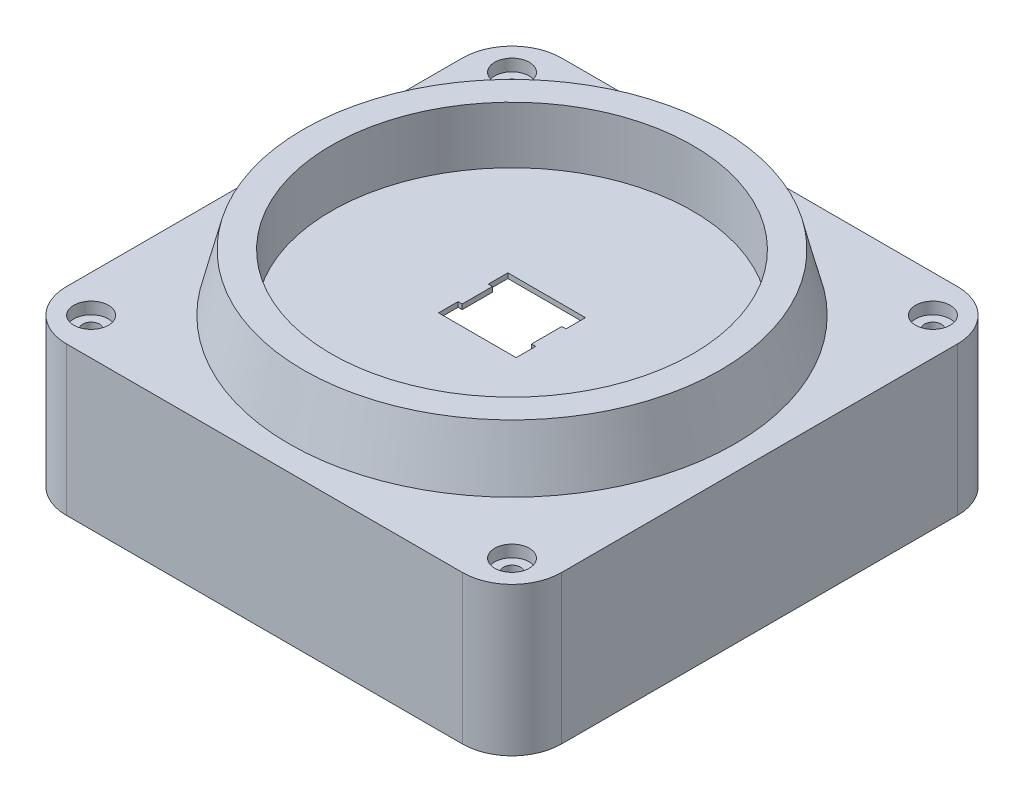
from build123d import *

# Parameters (mm, degrees)
SKIZZE1_R                                            = 1.5
AUFSATZ_LINEAR_AUSTRAGEN1_DEPTH                      = 30
AUFSATZ_LINEAR_AUSTRAGEN2_DEPTH                      = 1
VERRUNDUNG1_R                                        = 10
VERRUNDUNG2_R                                        = 12
STIRNSENKUNG_F_R_M3_FLACHKOPFSCHRAUBE_MI_D           = 3.4
STIRNSENKUNG_F_R_M3_FLACHKOPFSCHRAUBE_MI_CBORE_D     = 7
STIRNSENKUNG_F_R_M3_FLACHKOPFSCHRAUBE_MI_CBORE_DEPTH = 2.4


with BuildPart() as part:
    # Skizze1 → Aufsatz-Linear austragen1 (new body)
    with BuildSketch(Plane(origin=(0, 0, 0), x_dir=(1, 0, 0), z_dir=(0, 1, 0))):
        Polygon((-50, 50), (50, 50), (50, -50), (-50, -50), (-50, 35), align=None)
        with Locations(Location((42.5, 42.5, 0), (0, 0, 270))):
            Circle(SKIZZE1_R, mode=Mode.SUBTRACT)
        with Locations(Location((-42.5, 42.5, 0), (0, 0, 270))):
            Circle(SKIZZE1_R, mode=Mode.SUBTRACT)
        with Locations(Location((42.5, -42.5, 0), (0, 0, 270))):
            Circle(SKIZZE1_R, mode=Mode.SUBTRACT)
        with Locations(Location((-42.5, -42.5, 0), (0, 0, 270))):
            Circle(SKIZZE1_R, mode=Mode.SUBTRACT)
        Polygon((-47, -35), (-35, -35), (-35, -47), (35, -47), (35, -35), (47, -35), (47, 35), (35, 35), (35, 47), (-35, 47), (-35, 35), (-47, 35), align=None, mode=Mode.SUBTRACT)
    extrude(amount=-AUFSATZ_LINEAR_AUSTRAGEN1_DEPTH)

    # Skizze1<3> → Aufsatz-Linear austragen2 (add)
    with BuildSketch(Plane(origin=(0, 0, 0), x_dir=(1, 0, 0), z_dir=(0, 1, 0))):
        Polygon((35, 47), (-35, 47), (-35, 35), (-47, 35), (-47, -35), (-35, -35), (-35, -47), (35, -47), (35, -35), (47, -35), (47, 35), (35, 35), align=None)
        Polygon((-7.8359, -3.0607), (-6.9977, -3.0607), (-6.9977, 3.0607), (-7.8359, 3.0607), (-7.8359, 6.9977), (-6.9977, 6.9977), (6.9977, 6.9977), (7.8359, 6.9977), (7.8359, 3.0607), (6.9977, 3.0607), (6.9977, -3.0607), (7.8359, -3.0607), (7.8359, -6.9977), (6.9977, -6.9977), (-6.9977, -6.9977), (-7.8359, -6.9977), align=None, mode=Mode.SUBTRACT)
    extrude(amount=-AUFSATZ_LINEAR_AUSTRAGEN2_DEPTH)

    # Verrundung1
    verrundung1_edges = [part.edges().sort_by_distance(p)[0] for p in [
        (50, -15, -50),
        (50, -15, 50),
        (-50, -15, 50),
        (-50, -15, -50),
    ]]
    fillet(verrundung1_edges, radius=VERRUNDUNG1_R)

    # Verrundung2
    verrundung2_edges = [part.edges().sort_by_distance(p)[0] for p in [
        (35, -15.5, 35),
        (-35, -15.5, 35),
        (35, -15.5, -35),
        (-35, -15.5, -35),
    ]]
    fillet(verrundung2_edges, radius=VERRUNDUNG2_R - 0.0001)  # a hair under: the kernel refuses the full size

    # Stirnsenkung für M3 Flachkopfschraube mit Schlitz1 (through all)
    with Locations(Plane(origin=(0, 0, 0), x_dir=(1, 0, 0), z_dir=(0, 1, 0))):
        with Locations((-42.5, -42.5), (-42.5, 42.5), (42.5, -42.5), (42.5, 42.5)):
            CounterBoreHole(STIRNSENKUNG_F_R_M3_FLACHKOPFSCHRAUBE_MI_D / 2, STIRNSENKUNG_F_R_M3_FLACHKOPFSCHRAUBE_MI_CBORE_D / 2, STIRNSENKUNG_F_R_M3_FLACHKOPFSCHRAUBE_MI_CBORE_DEPTH)

    # Skizze9 → Rotation1 (revolve)
    with BuildSketch(Plane.XY):
        Polygon((45.009357924, 0), (42.120640981, 11.470793218), (36.483893338, 11.470793218), (36.483893338, 0), align=None)
    revolve(axis=Axis((0, -1000, 0), (0, 1, 0)))


solid = part.part
